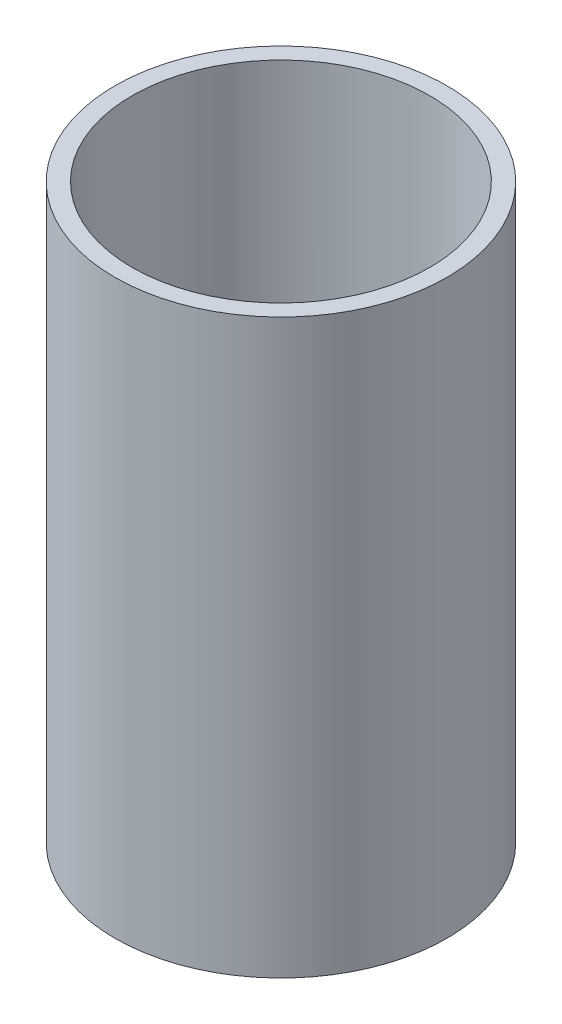
from build123d import *

# Parameters (mm, degrees)
SKETCH1_R           = 2.9
SKETCH1_R_2         = 2.6
BOSS_EXTRUDE1_DEPTH = 10
SKETCH2_R           = 1.5
CUT_EXTRUDE1_DEPTH  = 10


with BuildPart() as part:
    # Sketch1 → Boss-Extrude1 (new body)
    with BuildSketch(Plane(origin=(0, 0, 0), x_dir=(1, 0, 0), z_dir=(0, 1, 0))):
        Circle(SKETCH1_R)
        Circle(SKETCH1_R_2, mode=Mode.SUBTRACT)
    extrude(amount=BOSS_EXTRUDE1_DEPTH)

    # Sketch2 → Cut-Extrude1 (cut)
    with BuildSketch(Plane.XY):
        with Locations((0, 4)):
            Circle(SKETCH2_R)
    extrude(amount=-CUT_EXTRUDE1_DEPTH, mode=Mode.SUBTRACT)


solid = part.part
